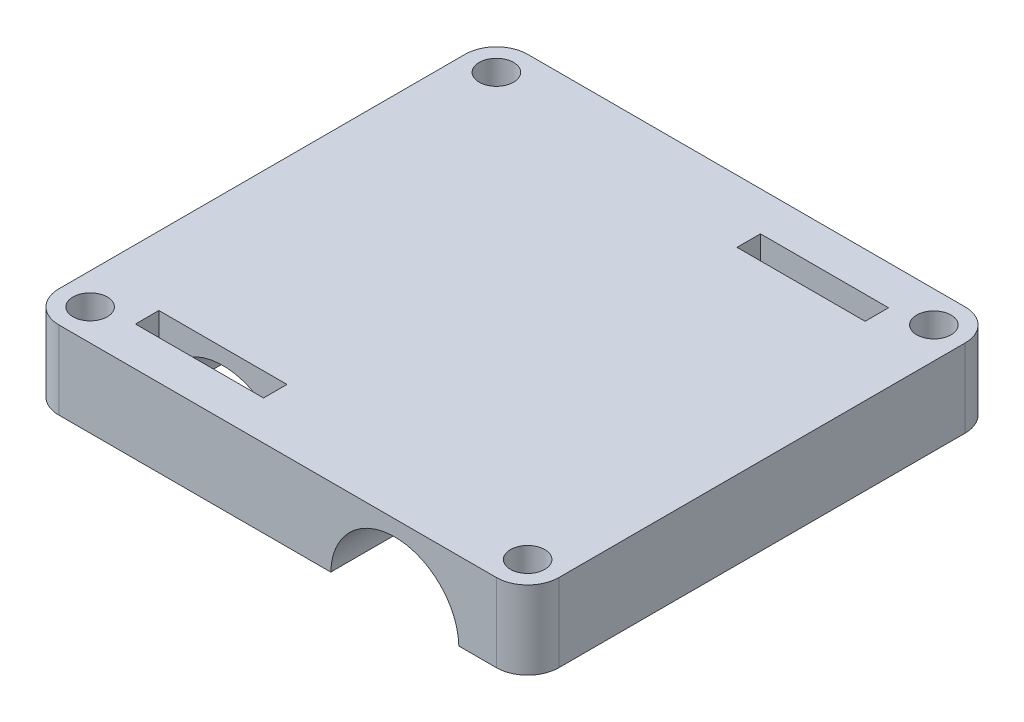
from build123d import *

# Parameters (mm, degrees)
SKETCH4_W           = 32
SKETCH4_H           = 30
BOSS_EXTRUDE2_DEPTH = 5
FILLET3_R           = 2
SKETCH11_R          = 4.1
CUT_EXTRUDE6_DEPTH  = 26
SKETCH12_R          = 4.1
CUT_EXTRUDE7_DEPTH  = 26
SKETCH13_R          = 1.1
CUT_EXTRUDE8_DEPTH  = 5
SKETCH14_W          = 8.197560613
SKETCH14_H          = 1.5
CUT_EXTRUDE9_DEPTH  = 5


with BuildPart() as part:
    # Sketch4 → Boss-Extrude2 (new body)
    with BuildSketch(Plane(origin=(0, 0, 0), x_dir=(1, 0, 0), z_dir=(0, 1, 0))):
        with Locations((-0.846416382, -7.935153584)):
            Rectangle(SKETCH4_W, SKETCH4_H)
    extrude(amount=BOSS_EXTRUDE2_DEPTH)

    # Fillet3
    fillet3_edges = [part.edges().sort_by_distance(p)[0] for p in [
        (15.153583618, 2.5, -7.064846416),
        (-16.846416382, 2.5, -7.064846416),
        (-16.846416382, 2.5, 22.935153584),
        (15.153583618, 2.5, 22.935153584),
    ]]
    fillet(fillet3_edges, radius=FILLET3_R)

    # Sketch11 → Cut-Extrude6 (cut)
    with BuildSketch(Plane(origin=(0, 0, -7.064846416), x_dir=(-1, 0, 0), z_dir=(0, 0, -1))):
        with Locations((8.346416382, -0.1)):
            Circle(SKETCH11_R)
    extrude(amount=-CUT_EXTRUDE6_DEPTH, mode=Mode.SUBTRACT)

    # Sketch12 → Cut-Extrude7 (cut)
    with BuildSketch(Plane.XY.offset(22.935153584)):
        with Locations((6.653583618, -0.1)):
            Circle(SKETCH12_R)
    extrude(amount=-CUT_EXTRUDE7_DEPTH, mode=Mode.SUBTRACT)

    # Sketch13 → Cut-Extrude8 (cut)
    with BuildSketch(Plane.XZ):
        with Locations((13.153583618, -5.064846416)):
            Circle(SKETCH13_R)
        with Locations((-14.846416382, -5.064846416)):
            Circle(SKETCH13_R)
        with Locations((-14.846416382, 20.935153584)):
            Circle(SKETCH13_R)
        with Locations((13.153583618, 20.935153584)):
            Circle(SKETCH13_R)
    extrude(amount=-CUT_EXTRUDE8_DEPTH, mode=Mode.SUBTRACT)

    # Sketch14 → Cut-Extrude9 (cut)
    with BuildSketch(Plane.XZ):
        with Locations((-8.346416383, 19.685153584)):
            Rectangle(SKETCH14_W, SKETCH14_H)
        with Locations((6.653583618, -3.814846416)):
            Rectangle(SKETCH14_W, SKETCH14_H)
    extrude(amount=-CUT_EXTRUDE9_DEPTH, mode=Mode.SUBTRACT)


solid = part.part
